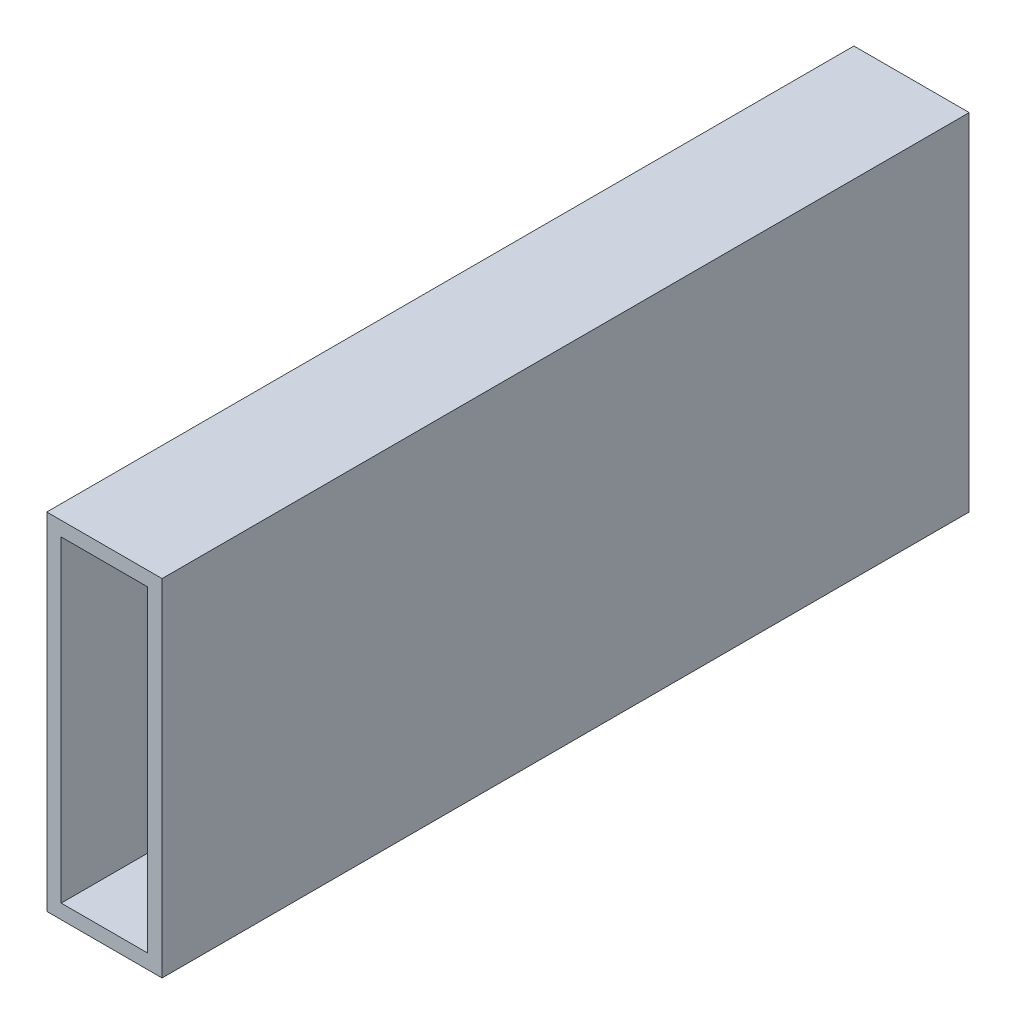
from build123d import *

# Parameters (mm, degrees)
SKETCH1_W           = 25.4
SKETCH1_H           = 76.2
BOSS_EXTRUDE1_DEPTH = 88.9
SHELL1_T            = -3.175


with BuildPart() as part:
    # Sketch1 → Boss-Extrude1 (new, symmetric)
    with BuildSketch(Plane.XY):
        Rectangle(SKETCH1_W, SKETCH1_H)
    extrude(amount=BOSS_EXTRUDE1_DEPTH, both=True)

    # Shell1
    shell1_openings = [part.faces().sort_by_distance(p)[0] for p in [
        (0, 0, -88.9),
        (0, 0, 88.9),
    ]]
    offset(amount=SHELL1_T, openings=shell1_openings, kind=Kind.INTERSECTION)


solid = part.part
